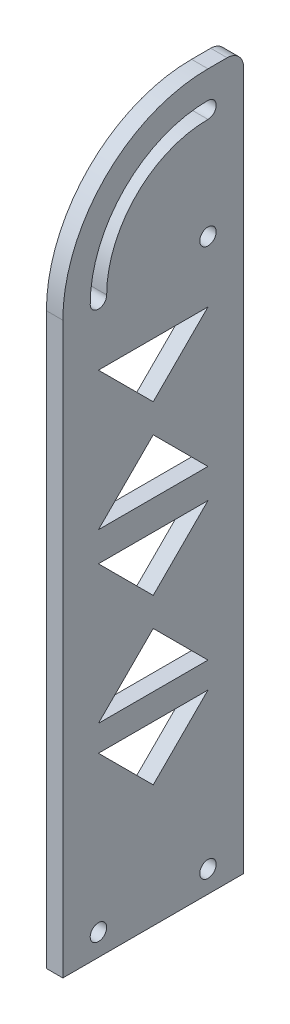
from build123d import *

# Parameters (mm, degrees)
SKETCH1_R           = 1.5
BOSS_EXTRUDE1_DEPTH = 3


with BuildPart() as part:
    # Sketch1 → Boss-Extrude1 (new body)
    with BuildSketch(Plane(origin=(0, 0, 0), x_dir=(0, 0, -1), z_dir=(1, 0, 0))):
        with BuildLine():
            Line((13.864315865, 86.580313897), (13.864315865, 110.080313897))
            ThreePointArc((13.864315865, 110.080313897), (12.985636209, 112.20163424), (10.864315865, 113.080313897))
            Line((10.864315865, 113.080313897), (7.364315865, 113.080313897))
            ThreePointArc((7.364315865, 113.080313897), (-11.374013836, 105.318643598), (-19.135684135, 86.580313897))
            Line((-19.135684135, 86.580313897), (-19.135684135, -17.419686103))
            Line((-19.135684135, -17.419686103), (-12.635684135, -17.419686103))
            Line((-12.635684135, -17.419686103), (7.364315865, -17.419686103))
            Line((7.364315865, -17.419686103), (13.864315865, -17.419686103))
            Line((13.864315865, -17.419686103), (13.864315865, 86.580313897))
        make_face()
        with Locations((-12.635684135, -13.419686103)):
            Circle(SKETCH1_R, mode=Mode.SUBTRACT)
        with Locations((7.364315865, -13.419686103)):
            Circle(SKETCH1_R, mode=Mode.SUBTRACT)
        with Locations((7.364315865, 86.580313897)):
            Circle(SKETCH1_R, mode=Mode.SUBTRACT)
        Polygon((-12.635684135, 75.437373014), (7.364315865, 75.437373014), (-2.635684135, 65.437373014), align=None, mode=Mode.SUBTRACT)
        Polygon((-2.635684135, 60.211537485), (-12.635684135, 50.211537485), (7.364315865, 50.211537485), align=None, mode=Mode.SUBTRACT)
        Polygon((-12.635684135, 44.820203743), (7.364315865, 44.820203743), (-2.635684135, 34.820203743), align=None, mode=Mode.SUBTRACT)
        Polygon((-2.635684135, 29.594368214), (-12.635684135, 19.594368214), (7.364315865, 19.594368214), align=None, mode=Mode.SUBTRACT)
        Polygon((-12.635684135, 14.865027321), (7.364315865, 14.865027321), (-2.635684135, 4.865027321), align=None, mode=Mode.SUBTRACT)
        with BuildLine():
            ThreePointArc((-14.135684135, 86.580313897), (-12.635684135, 85.080313897), (-11.135684135, 86.580313897))
            ThreePointArc((-11.135684135, 86.580313897), (-5.717159587, 99.661789349), (7.364315865, 105.080313897))
            ThreePointArc((7.364315865, 105.080313897), (8.864315865, 106.580313897), (7.364315865, 108.080313897))
            ThreePointArc((7.364315865, 108.080313897), (-7.83847993, 101.783109692), (-14.135684135, 86.580313897))
        make_face(mode=Mode.SUBTRACT)
    extrude(amount=BOSS_EXTRUDE1_DEPTH)


solid = part.part
